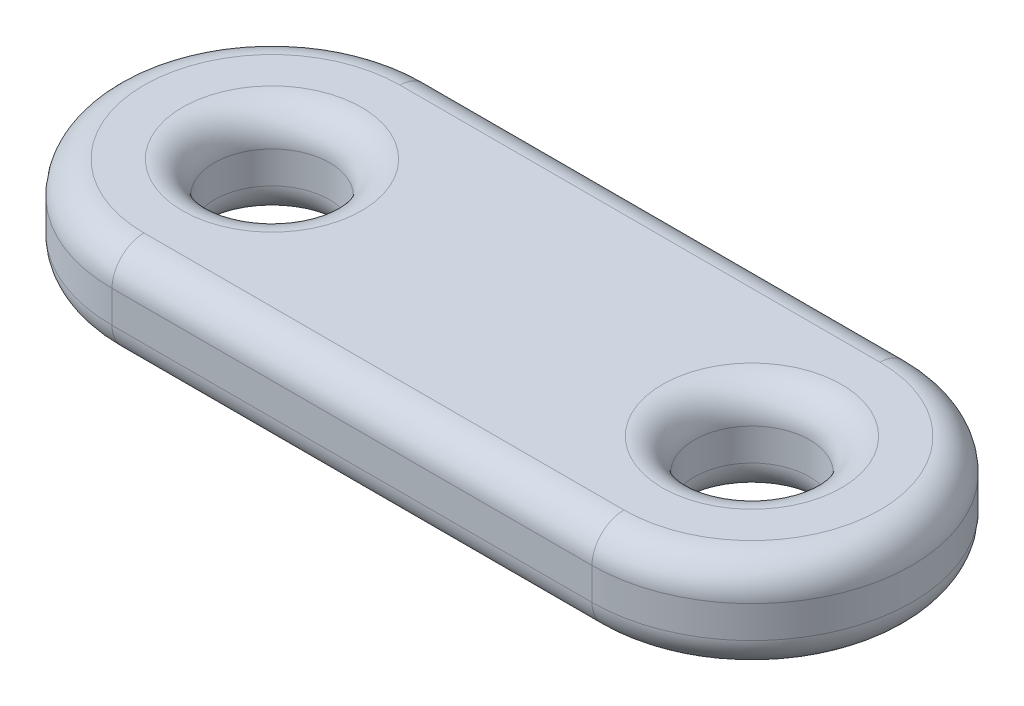
from build123d import *

# Parameters (mm, degrees)
BOSS_EXTRUDE1_DEPTH  = 3
M3_CLEARANCE_HOLE1_D = 3.6
FILLET1_R            = 1


with BuildPart() as part:
    # Sketch1 → Boss-Extrude1 (new body)
    with BuildSketch(Plane(origin=(0, 0, 0), x_dir=(1, 0, 0), z_dir=(0, 1, 0))):
        with BuildLine():
            Line((-7.5, 5), (7.5, 5))
            ThreePointArc((7.5, 5), (12.5, 0), (7.5, -5))
            Line((7.5, -5), (-7.5, -5))
            ThreePointArc((-7.5, -5), (-12.5, 0), (-7.5, 5))
        make_face()
    extrude(amount=BOSS_EXTRUDE1_DEPTH)

    # M3 Clearance Hole1 (through all)
    with Locations(Plane.XZ):
        with Locations((-7.5, 0), (7.5, 0)):
            Hole(M3_CLEARANCE_HOLE1_D / 2)

    # Fillet1
    fillet1_edges = [part.edges().sort_by_distance(p)[0] for p in [
        (0, 0, 5),
        (12.5, 0, 0),
        (0, 0, -5),
        (-12.5, 0, 0),
        (0, 3, -5),
        (12.5, 3, 0),
        (0, 3, 5),
        (-12.5, 3, 0),
        (9.3, 0, 0),
        (-5.7, 0, 0),
        (9.3, 3, 0),
        (-5.7, 3, 0),
    ]]
    fillet(fillet1_edges, radius=FILLET1_R)


solid = part.part
